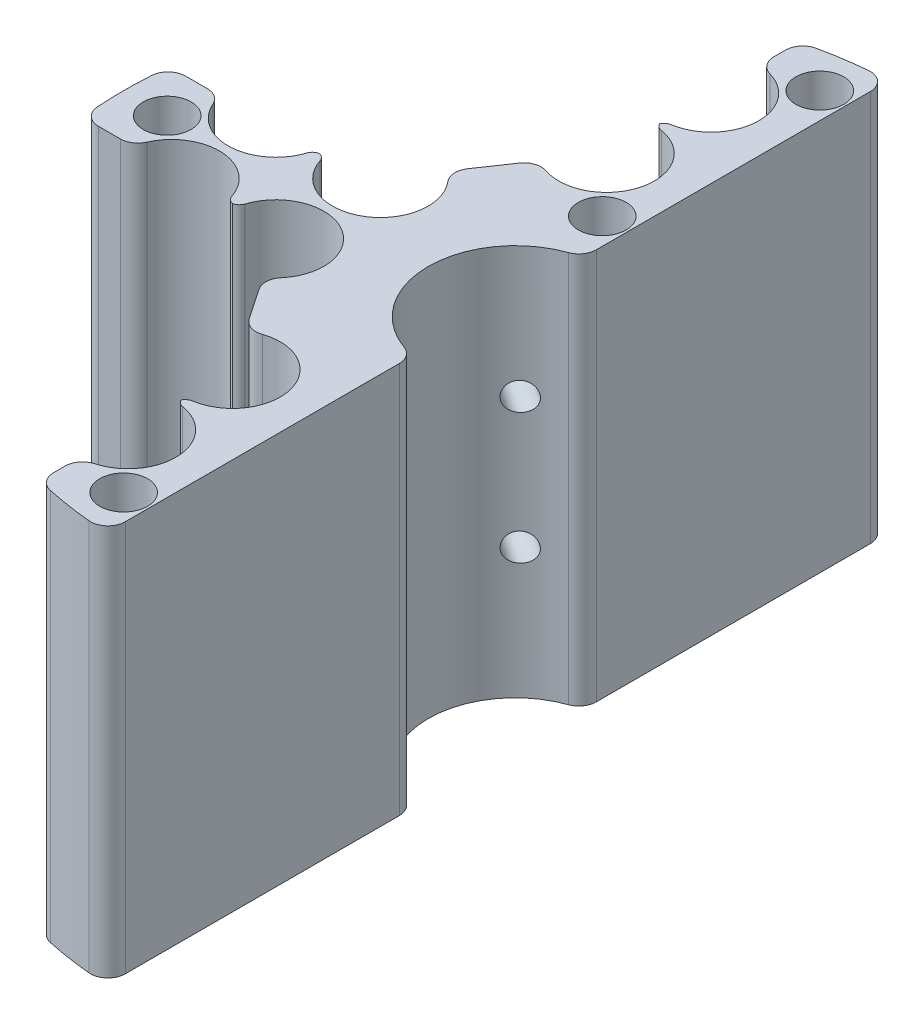
from build123d import *

# Parameters (mm, degrees)
BOSS_EXTRUDE1_DEPTH = 45
SKETCH2_R           = 2.75
CUT_EXTRUDE1_DEPTH  = 45
SKETCH3_R           = 5.5
CUT_EXTRUDE2_DEPTH  = 45
CUT_EXTRUDE3_DEPTH  = 45
SKETCH5_R           = 1.6
CUT_EXTRUDE5_DEPTH  = 15
SKETCH6_R           = 1.6
CUT_EXTRUDE6_DEPTH  = 15
FILLET1_R           = 2
FILLET2_R           = 1
FILLET3_R           = 2
FILLET4_R           = 1
SKETCH7_W           = 1
SKETCH7_H           = 92.409175645
CUT_EXTRUDE7_DEPTH  = 45
FILLET8_R           = 2


with BuildPart() as part:
    # Sketch1 → Boss-Extrude1 (new body)
    with BuildSketch(Plane(origin=(0, 0, 0), x_dir=(1, 0, 0), z_dir=(0, 1, 0))):
        with BuildLine():
            Line((-1, 9.949874371), (-1, 44.988887517))
            ThreePointArc((-1, 44.988887517), (-45, 0), (-1, -44.988887517))
            Line((-1, -44.988887517), (-1, -9.949874371))
            ThreePointArc((-1, -9.949874371), (-10, 0), (-1, 9.949874371))
        make_face()
    extrude(amount=BOSS_EXTRUDE1_DEPTH)

    # Sketch2 → Cut-Extrude1 (cut)
    with BuildSketch(Plane(origin=(0, 45, 0), x_dir=(1, 0, 0), z_dir=(0, 1, 0))):
        with Locations(Location((-40, 0, 0), (0, 0, 270))):
            Circle(SKETCH2_R)
        with Locations(Location((-5, 15, 0), (0, 0, 270))):
            Circle(SKETCH2_R)
        with Locations(Location((-5, 40, 0), (0, 0, 270))):
            Circle(SKETCH2_R)
        with Locations(Location((-5, -40, 0), (0, 0, 270))):
            Circle(SKETCH2_R)
    extrude(amount=-CUT_EXTRUDE1_DEPTH, mode=Mode.SUBTRACT)

    # Sketch3 → Cut-Extrude2 (cut)
    with BuildSketch(Plane(origin=(0, 45, 0), x_dir=(1, 0, 0), z_dir=(0, 1, 0))):
        with Locations(Location((-33.5, 6, 0), (0, 0, 270))):
            Circle(SKETCH3_R)
        with Locations(Location((-21.5, 6, 0), (0, 0, 270))):
            Circle(SKETCH3_R)
        with Locations(Location((-11, 21.5, 0), (0, 0, 270))):
            Circle(SKETCH3_R)
        with Locations(Location((-11, 33.5, 0), (0, 0, 270))):
            Circle(SKETCH3_R)
        with Locations(Location((-33.5, -6, 0), (0, 0, 270))):
            Circle(SKETCH3_R)
        with Locations(Location((-21.5, -6, 0), (0, 0, 270))):
            Circle(SKETCH3_R)
        with Locations(Location((-11, -33.5, 0), (0, 0, 270))):
            Circle(SKETCH3_R)
        with Locations(Location((-11, -21.5, 0), (0, 0, 270))):
            Circle(SKETCH3_R)
    extrude(amount=-CUT_EXTRUDE2_DEPTH, mode=Mode.SUBTRACT)

    # Sketch4 → Cut-Extrude3 (cut)
    with BuildSketch(Plane(origin=(0, 45, 0), x_dir=(1, 0, 0), z_dir=(0, 1, 0))):
        with BuildLine():
            ThreePointArc((-11, 43.634848459), (-33.902512538, 29.590870951), (-44.72135955, 5))
            Line((-44.72135955, 5), (-38.908326913, 5))
            ThreePointArc((-38.908326913, 5), (-34.002096593, 11.477033779), (-28, 6))
            ThreePointArc((-28, 6), (-28.022966221, 5.497903407), (-28.091673087, 5))
            Line((-28.091673087, 5), (-27.5, 5))
            Line((-27.5, 5), (-26.908326913, 5))
            ThreePointArc((-26.908326913, 5), (-24.51323898, 10.601129302), (-18.421669276, 10.557837201))
            Line((-18.421669276, 10.557837201), (-14.087297918, 16.948232039))
            ThreePointArc((-14.087297918, 16.948232039), (-16.257600393, 23.11481829), (-11, 27))
            Line((-11, 27), (-11, 28))
            ThreePointArc((-11, 28), (-16.5, 33.5), (-11, 39))
            Line((-11, 39), (-11, 43.634848459))
        make_face()
        with BuildLine():
            Line((-38.908326913, -5), (-44.72135955, -5))
            ThreePointArc((-44.72135955, -5), (-33.902512538, -29.590870951), (-11, -43.634848459))
            Line((-11, -43.634848459), (-11, -39))
            ThreePointArc((-11, -39), (-16.5, -33.5), (-11, -28))
            Line((-11, -28), (-11, -27))
            ThreePointArc((-11, -27), (-16.257600393, -23.11481829), (-14.087297918, -16.948232039))
            Line((-14.087297918, -16.948232039), (-18.421669276, -10.557837201))
            ThreePointArc((-18.421669276, -10.557837201), (-24.51323898, -10.601129302), (-26.908326913, -5))
            Line((-26.908326913, -5), (-27.5, -5))
            Line((-27.5, -5), (-28.091673087, -5))
            ThreePointArc((-28.091673087, -5), (-28.022966221, -5.497903407), (-28, -6))
            ThreePointArc((-28, -6), (-34.002096593, -11.477033779), (-38.908326913, -5))
        make_face()
    extrude(amount=-CUT_EXTRUDE3_DEPTH, mode=Mode.SUBTRACT)

    # Sketch5 → Cut-Extrude5 (cut)
    with BuildSketch(Plane(origin=(-17.521876952, 0, -11.884449008), x_dir=(-0.5613268941159263, 0, 0.8275941746666465), z_dir=(-0.8275941746666464, 0, -0.5613268941159262))):
        with Locations((-2.257852543, 30)):
            Circle(SKETCH5_R)
        with Locations((-2.257852543, 15)):
            Circle(SKETCH5_R)
    extrude(amount=-CUT_EXTRUDE5_DEPTH, mode=Mode.SUBTRACT)

    # Sketch6 → Cut-Extrude6 (cut)
    with BuildSketch(Plane(origin=(-17.521876952, 0, 11.884449008), x_dir=(0.5613268941159263, 0, 0.8275941746666465), z_dir=(-0.8275941746666464, 0, 0.5613268941159262))):
        with Locations((2.257852543, 30)):
            Circle(SKETCH6_R)
        with Locations((2.257852543, 15)):
            Circle(SKETCH6_R)
    extrude(amount=-CUT_EXTRUDE6_DEPTH, mode=Mode.SUBTRACT)

    # Fillet1
    fillet1_edges = [part.edges().sort_by_distance(p)[0] for p in [
        (-18.421669276, 22.5, 10.557837201),
        (-14.087297918, 22.5, 16.948232039),
        (-14.087297918, 22.5, -16.948232039),
        (-18.421669276, 22.5, -10.557837201),
    ]]
    fillet(fillet1_edges, radius=FILLET1_R)

    # Fillet2
    # the kernel refuses this fillet: 1 mm, written as the material it takes off along each edge
    with BuildSketch(Plane(origin=(-11, 47.306540723, 28), x_dir=(0.9970192610334746, 0, 0.0771530500256742), z_dir=(0, -1, 0)), Plane(origin=(-11, 47.306540723, -27), x_dir=(0.9970192610334746, 0, 0.0771530500256742), z_dir=(0, -1, 0))) as fillet2_piece_1:
        with BuildLine():
            CenterArc((0.9258366, -0.997019261), FILLET2_R, 94.424941549, 81.150116902)
            Line((-0.071182661, -0.919866211), (0, 0))
            ThreePointArc((0, 0), (0.424341775, -0.016394064), (0.84868355, 0))
        make_face()
    extrude(amount=49.613081447, mode=Mode.SUBTRACT)
    with BuildSketch(Plane(origin=(-11, 47.306540723, 27), x_dir=(0, 0, 1), z_dir=(0, -1, 0)), Plane(origin=(-11, 47.306540723, -28), x_dir=(0, 0, 1), z_dir=(0, -1, 0))) as fillet2_piece_2:
        with BuildLine():
            CenterArc((0.922616289, -1), FILLET2_R, 90, 81.150116902)
            ThreePointArc((-0.065478524, -0.846153846), (-0.016394064, -0.424341775), (0, 0))
            Line((0, 0), (0.922616289, 0))
        make_face()
    extrude(amount=49.613081447, mode=Mode.SUBTRACT)

    # Fillet3
    fillet3_edges = [part.edges().sort_by_distance(p)[0] for p in [
        (-11, 22.5, 39),
        (-11, 22.5, 43.634848459),
        (-44.72135955, 22.5, 5),
        (-38.908326913, 22.5, 5),
        (-38.908326913, 22.5, -5),
        (-44.72135955, 22.5, -5),
        (-11, 22.5, -43.634848459),
        (-11, 22.5, -39),
    ]]
    fillet(fillet3_edges, radius=FILLET3_R)

    # Fillet4
    # the kernel refuses this fillet: 1 mm, written as the material it takes off along each edge
    with BuildSketch(Plane(origin=(-26.908326913, 46.940828813, 5), x_dir=(-1, 0, 0), z_dir=(0, -1, 0)), Plane(origin=(-28.091673087, 46.940828813, -5), x_dir=(1, 0, 0), z_dir=(0, -1, 0))) as fillet4_piece_1:
        with BuildLine():
            CenterArc((0.776331525, 1), FILLET4_R, 197.920213139, 72.079786861)
            ThreePointArc((-0.175154388, 0.692307692), (-0.076329158, 0.348999608), (0, 0))
            Line((0, 0), (0.776331525, 0))
        make_face()
    extrude(amount=48.881657626, mode=Mode.SUBTRACT)
    with BuildSketch(Plane(origin=(-28.091673087, 46.940828813, 5), x_dir=(-0.24527265600487286, 0, -0.9694541372423533), z_dir=(0, -1, 0)), Plane(origin=(-26.908326913, 46.940828813, -5), x_dir=(0.2452726560048734, 0, 0.9694541372423531), z_dir=(0, -1, 0))) as fillet4_piece_2:
        with BuildLine():
            CenterArc((0.779041242, 0.997890465), FILLET4_R, 194.197947418, 72.079786861)
            Line((-0.190412895, 0.752617809), (0, 0))
            ThreePointArc((0, 0), (0.357060569, 0.011602442), (0.714121139, 0))
        make_face()
    extrude(amount=48.881657626, mode=Mode.SUBTRACT)

    # Sketch7 → Cut-Extrude7 (cut)
    with BuildSketch(Plane(origin=(0, 45, 0), x_dir=(1, 0, 0), z_dir=(0, 1, 0))):
        with Locations((-1.5, -1.215700306)):
            Rectangle(SKETCH7_W, SKETCH7_H)
    extrude(amount=-CUT_EXTRUDE7_DEPTH, mode=Mode.SUBTRACT)

    # Fillet8
    fillet8_edges = [part.edges().sort_by_distance(p)[0] for p in [
        (-2, 22.5, -44.955533586),
        (-2, 22.5, 44.955533586),
        (-2, 22.5, -9.797958971),
        (-2, 22.5, 9.797958971),
    ]]
    fillet(fillet8_edges, radius=FILLET8_R)


solid = part.part
